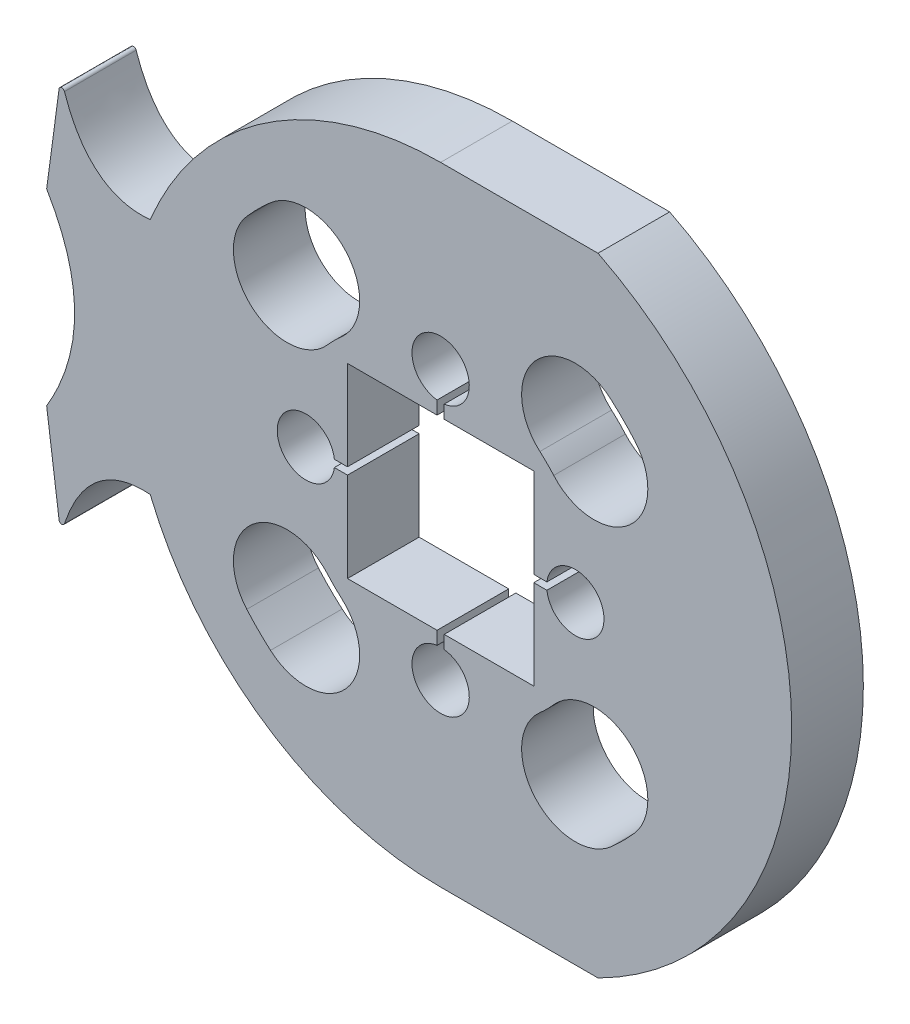
from build123d import *

# Parameters (mm, degrees)
BOSS_EXTRUDE1_DEPTH = 6.35


with BuildPart() as part:
    # Sketch1 → Boss-Extrude1 (new body)
    with BuildSketch(Plane.XY):
        with BuildLine():
            Line((13.949202701, 27.813), (0, 27.813))
            ThreePointArc((0, 27.813), (-15.495722247, 23.096440441), (-25.735880772, 10.546440626))
            add(Edge.make_bspline(
                [(-33.335263894, 16.577622785), (-31.897734861, 12.244147731), (-29.218007482, 10.187725291), (-25.735880772, 10.546440626)],
                knots=[0.081540764, 0.081540764, 0.081540764, 0.081540764, 1, 1, 1, 1], degree=3))
            ThreePointArc((-33.335263894, 16.577622785), (-33.559636624, 16.751099462), (-33.804841532, 16.608579877))
            Line((-33.804841532, 16.608579877), (-34.917209585, 8.319768485))
            add(Edge.make_bspline(
                [(-34.917209585, 8.319768485), (-29.956448806, 0), (-34.917209585, -8.319768485)],
                knots=[0, 0, 0, 1, 1, 1], degree=2))
            Line((-34.917209585, -8.319768485), (-33.804841532, -16.608579877))
            ThreePointArc((-33.804841532, -16.608579877), (-33.559636624, -16.751099462), (-33.335263894, -16.577622785))
            add(Edge.make_bspline(
                [(-33.335263894, -16.577622785), (-31.897734861, -12.244147731), (-29.230448697, -10.289617961), (-25.735880772, -10.546440626)],
                knots=[0.081540764, 0.081540764, 0.081540764, 0.081540764, 1, 1, 1, 1], degree=3))
            ThreePointArc((-25.735880772, -10.546440626), (-15.495722247, -23.096440441), (0, -27.813))
            Line((0, -27.813), (13.949202701, -27.813))
            ThreePointArc((13.949202701, -27.813), (31.115, 0), (13.949202701, 27.813))
        make_face()
        with BuildLine():
            ThreePointArc((-17.180974907, -15.079578947), (-16.743184082, -8.358630228), (-10.022235363, -8.796421053))
            ThreePointArc((-10.022235363, -8.796421053), (-9.429268927, -9.429268927), (-8.796421053, -10.022235363))
            ThreePointArc((-8.796421053, -10.022235363), (-8.358630228, -16.743184082), (-15.079578947, -17.180974907))
            ThreePointArc((-15.079578947, -17.180974907), (-16.164461018, -16.164461018), (-17.180974907, -15.079578947))
        make_face(mode=Mode.SUBTRACT)
        with BuildLine():
            ThreePointArc((15.079578947, -17.180974907), (8.358630228, -16.743184082), (8.796421053, -10.022235363))
            ThreePointArc((8.796421053, -10.022235363), (9.429268927, -9.429268927), (10.022235363, -8.796421053))
            ThreePointArc((10.022235363, -8.796421053), (16.743184082, -8.358630228), (17.180974907, -15.079578947))
            ThreePointArc((17.180974907, -15.079578947), (16.164461018, -16.164461018), (15.079578947, -17.180974907))
        make_face(mode=Mode.SUBTRACT)
        with BuildLine():
            ThreePointArc((-10.022235363, 8.796421053), (-16.743184082, 8.358630228), (-17.180974907, 15.079578947))
            ThreePointArc((-17.180974907, 15.079578947), (-16.164461018, 16.164461018), (-15.079578947, 17.180974907))
            ThreePointArc((-15.079578947, 17.180974907), (-8.358630228, 16.743184082), (-8.796421053, 10.022235363))
            ThreePointArc((-8.796421053, 10.022235363), (-9.429268927, 9.429268927), (-10.022235363, 8.796421053))
        make_face(mode=Mode.SUBTRACT)
        with BuildLine():
            Line((-8.255, 0.3175), (-8.255, 8.255))
            Line((-8.255, 8.255), (-0.3175, 8.255))
            Line((-0.3175, 8.255), (-0.3175, 9.417921876))
            ThreePointArc((-0.3175, 9.417921876), (-1.680052083, 13.843), (2.54, 11.938))
            ThreePointArc((2.54, 11.938), (1.905, 10.257947917), (0.3175, 9.417921876))
            Line((0.3175, 9.417921876), (0.3175, 8.255))
            Line((0.3175, 8.255), (8.255, 8.255))
            Line((8.255, 8.255), (8.255, 0.3175))
            Line((8.255, 0.3175), (9.417921876, 0.3175))
            ThreePointArc((9.417921876, 0.3175), (12.097062198, 2.535014638), (14.478, 0))
            ThreePointArc((14.478, 0), (12.097062198, -2.535014638), (9.417921876, -0.3175))
            Line((9.417921876, -0.3175), (8.255, -0.3175))
            Line((8.255, -0.3175), (8.255, -8.255))
            Line((8.255, -8.255), (0.3175, -8.255))
            Line((0.3175, -8.255), (0.3175, -9.417921876))
            ThreePointArc((0.3175, -9.417921876), (1.905, -10.257947917), (2.54, -11.938))
            ThreePointArc((2.54, -11.938), (-1.680052083, -13.843), (-0.3175, -9.417921876))
            Line((-0.3175, -9.417921876), (-0.3175, -8.255))
            Line((-0.3175, -8.255), (-8.255, -8.255))
            Line((-8.255, -8.255), (-8.255, -0.3175))
            Line((-8.255, -0.3175), (-9.417921876, -0.3175))
            ThreePointArc((-9.417921876, -0.3175), (-14.478, 0), (-9.417921876, 0.3175))
            Line((-9.417921876, 0.3175), (-8.255, 0.3175))
        make_face(mode=Mode.SUBTRACT)
        with BuildLine():
            ThreePointArc((17.180974907, 15.079578947), (16.743184082, 8.358630228), (10.022235363, 8.796421053))
            ThreePointArc((10.022235363, 8.796421053), (9.429268927, 9.429268927), (8.796421053, 10.022235363))
            ThreePointArc((8.796421053, 10.022235363), (8.358630228, 16.743184082), (15.079578947, 17.180974907))
            ThreePointArc((15.079578947, 17.180974907), (16.164461018, 16.164461018), (17.180974907, 15.079578947))
        make_face(mode=Mode.SUBTRACT)
    extrude(amount=BOSS_EXTRUDE1_DEPTH)


solid = part.part
